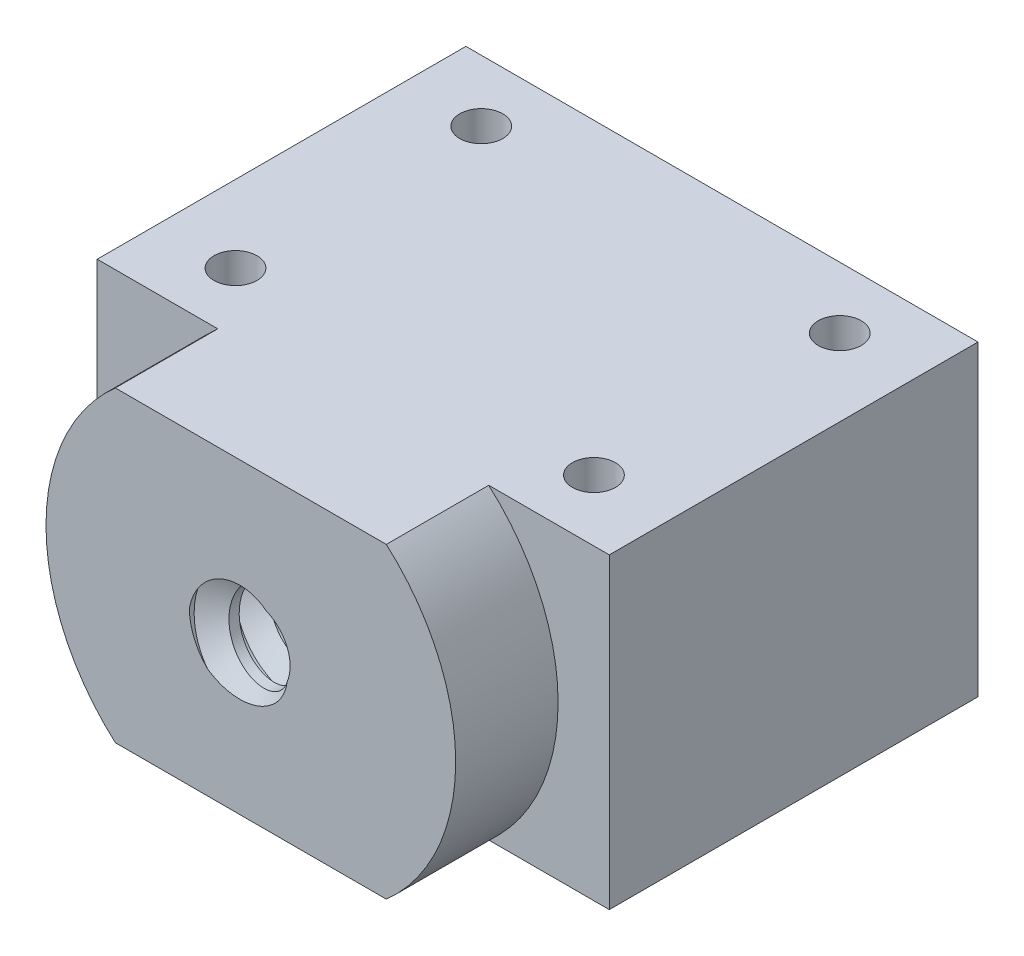
from build123d import *

# Parameters (mm, degrees)
SKETCH1_W             = 50
SKETCH1_H             = 30
SKETCH1_R             = 6
BOSS_EXTRUDE1_DEPTH   = 36
M5_TAPPED_HOLE2_D     = 4.2
M5_TAPPED_HOLE2_DEPTH = 10
M5_TAPPED_HOLE2_TIP   = 1.2618073
SKETCH6_R             = 6
BOSS_EXTRUDE3_DEPTH   = 10
SKETCH8_R             = 11
CUT_EXTRUDE1_DEPTH    = 6
THREAD1_PITCH         = 4
THREAD1_FROM          = 6
THREAD1_TO            = 46


with BuildPart() as part:
    # Sketch1 → Boss-Extrude1 (new body)
    with BuildSketch(Plane.XY):
        Rectangle(SKETCH1_W, SKETCH1_H)
        Circle(SKETCH1_R, mode=Mode.SUBTRACT)
    extrude(amount=BOSS_EXTRUDE1_DEPTH)

    # M5 Tapped Hole2
    with Locations(Plane(origin=(0, 15, 0), x_dir=(1, 0, 0), z_dir=(0, 1, 0))):
        with Locations((-17.5, -6), (17.5, -6), (17.5, -30), (-17.5, -30)):
            Hole(M5_TAPPED_HOLE2_D / 2, depth=M5_TAPPED_HOLE2_DEPTH)
            with Locations((0, 0, -(M5_TAPPED_HOLE2_DEPTH + M5_TAPPED_HOLE2_TIP / 2))):  # 118° drill point
                Cone(0, M5_TAPPED_HOLE2_D / 2, M5_TAPPED_HOLE2_TIP, mode=Mode.SUBTRACT)

    # Sketch6 → Boss-Extrude3 (add)
    with BuildSketch(Plane.XY.offset(36)):
        with BuildLine():
            Line((-13.228756555, -15), (13.228756555, -15))
            ThreePointArc((13.228756555, -15), (20, 0), (13.228756555, 15))
            Line((13.228756555, 15), (-13.228756555, 15))
            ThreePointArc((-13.228756555, 15), (-20, 0), (-13.228756555, -15))
        make_face()
        Circle(SKETCH6_R, mode=Mode.SUBTRACT)
    extrude(amount=BOSS_EXTRUDE3_DEPTH)

    # Sketch8 → Cut-Extrude1 (cut)
    with BuildSketch(Plane(origin=(0, 0, 0), x_dir=(-1, 0, 0), z_dir=(0, 0, -1))):
        Circle(SKETCH8_R)
    extrude(amount=-CUT_EXTRUDE1_DEPTH, mode=Mode.SUBTRACT)

    # Thread1: arcs per turn and ends read off the stored shape
    # Thread1: the profile of Thread Profile2 profile screwed along a right-hand helix through 11.5 turns, 12 arcs to a turn; built about Z, then put on its axis
    thread1_z = Axis((0, 0, 0), (0, 0, 1))
    thread1_corners = [(6.0003, 0, -0.000173205), (6.0003, 0, 3.500173194), (3.8349365, 0, 2.249999995), (3.8349365, 0, 1.249999995)]
    with BuildLine(mode=Mode.PRIVATE) as thread1_profile:
        Line(thread1_corners[0], thread1_corners[1])
        Line(thread1_corners[1], thread1_corners[2])
        Line(thread1_corners[2], thread1_corners[3])
        Line(thread1_corners[3], thread1_corners[0])
    thread1_cap = Face(thread1_profile.wire())
    thread1_turn_angles = [0, 15, 30, 45, 60, 75, 90, 105, 120, 135, 150, 165, 180, 195, 210, 225, 240, 255, 270, 285, 300, 315, 330, 345, 360]
    thread1_turn_weights = [1, 0.9659258262890683, 1, 0.9659258262890683, 1, 0.9659258262890683, 1, 0.9659258262890683, 1, 0.9659258262890683, 1, 0.9659258262890683, 1, 0.9659258262890683, 1, 0.9659258262890683, 1, 0.9659258262890683, 1, 0.9659258262890683, 1, 0.9659258262890683, 1, 0.9659258262890683, 1]
    thread1_turn_rails = [Edge.make_bspline([Vector(p[0], p[1], 0).rotate(thread1_z, thread1_turn_angles[k]) / thread1_turn_weights[k] + Vector(0, 0, p[2] + THREAD1_PITCH * thread1_turn_angles[k] / 360) for k in range(25)], [0, 0, 0, 1, 1, 2, 2, 3, 3, 4, 4, 5, 5, 6, 6, 7, 7, 8, 8, 9, 9, 10, 10, 11, 11, 12, 12, 12], 2, thread1_turn_weights) for p in thread1_corners]
    thread1_turn_sides = [Face.make_surface_from_curves(thread1_turn_rails[p[0]], thread1_turn_rails[p[1]]) for p in [(0, 1), (1, 2), (2, 3), (3, 0)]]
    thread1_last_angles = [3960, 3975, 3990, 4005, 4020, 4035, 4050, 4065, 4080, 4095, 4110, 4125, 4140]
    thread1_last_weights = [1, 0.9659258262890683, 1, 0.9659258262890683, 1, 0.9659258262890683, 1, 0.9659258262890683, 1, 0.9659258262890683, 1, 0.9659258262890683, 1]
    thread1_last_rails = [Edge.make_bspline([Vector(p[0], p[1], 0).rotate(thread1_z, thread1_last_angles[k]) / thread1_last_weights[k] + Vector(0, 0, p[2] + THREAD1_PITCH * thread1_last_angles[k] / 360) for k in range(13)], [0, 0, 0, 1, 1, 2, 2, 3, 3, 4, 4, 5, 5, 6, 6, 6], 2, thread1_last_weights) for p in thread1_corners]
    thread1_last_sides = [Face.make_surface_from_curves(thread1_last_rails[p[0]], thread1_last_rails[p[1]]) for p in [(0, 1), (1, 2), (2, 3), (3, 0)]]
    thread1 = Plane(origin=(0, 0, 0), x_dir=(1, 0, 0), z_dir=(0, 0, 1)) * split(split(Solid(Shell([*[p.moved(Location((0, 0, THREAD1_PITCH * i))) for i in range(11) for p in thread1_turn_sides], *thread1_last_sides, thread1_cap, thread1_cap.rotate(thread1_z, 4140).moved(Location((0, 0, THREAD1_PITCH * 4140 / 360)))])), bisect_by=Plane.XY.offset(THREAD1_FROM), keep=Keep.TOP, mode=Mode.PRIVATE), bisect_by=Plane.XY.offset(THREAD1_TO), keep=Keep.BOTTOM, mode=Mode.PRIVATE)
    add(thread1)


solid = part.part
